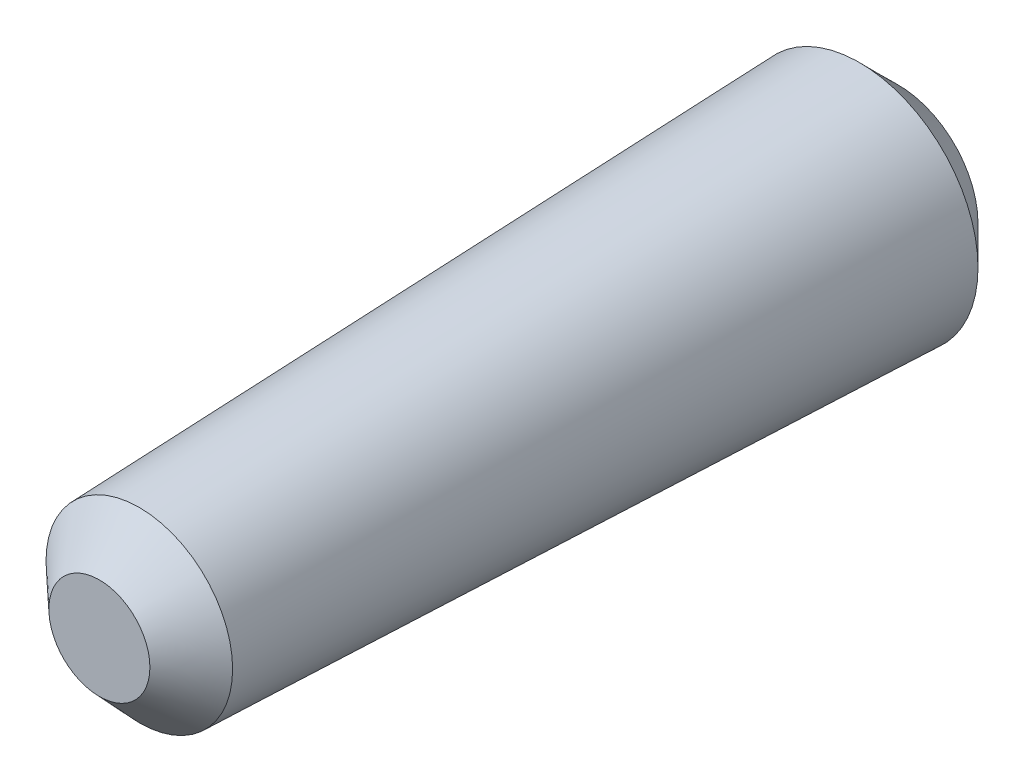
from build123d import *

# Parameters (mm, degrees)
SKETCH_1_R       = 3
EXTRUDE_1_DEPTH  = 20
EXTRUDE_1_TAPER  = 2
CHAMFER_1_SIZE   = 1
CHAMFER_1_SIZE_2 = 0.96684652
CHAMFER_1_SIZE_3 = 1.036815955


with BuildPart() as part:
    # 草图1 → 凸台-拉伸1 (new body)
    with BuildSketch(Plane.XY):
        Circle(SKETCH_1_R)
    extrude(amount=EXTRUDE_1_DEPTH, taper=EXTRUDE_1_TAPER)

    # 倒角1
    # the kernel refuses this chamfer: 1.036815955, 1, 0.96684652 mm, written as the material it takes off along each edge
    with BuildSketch(Plane(origin=(0, 0, 0), x_dir=(1, 0, 0), z_dir=(0, 1, 0))) as chamfer_1_piece_1:
        Polygon((3 - CHAMFER_1_SIZE, 0), (3 - CHAMFER_1_SIZE_2 * 0.0348994966969, -CHAMFER_1_SIZE_2 * 0.999390826859), (3, 0), align=None)
    revolve(axis=Axis((0, 0, 0), (0, 0, -1)), mode=Mode.SUBTRACT)
    with BuildSketch(Plane(origin=(0, 0, 20), x_dir=(1, 0, 0), z_dir=(0, 1, 0))) as chamfer_1_piece_2:
        Polygon((2.30158461 + CHAMFER_1_SIZE * 0.0348994967025, CHAMFER_1_SIZE * 0.999390827019), (2.30158461 - CHAMFER_1_SIZE_3, 0), (2.30158461, 0), align=None)
    revolve(axis=Axis((0, 0, 20), (0, 0, -1)), mode=Mode.SUBTRACT)


solid = part.part
